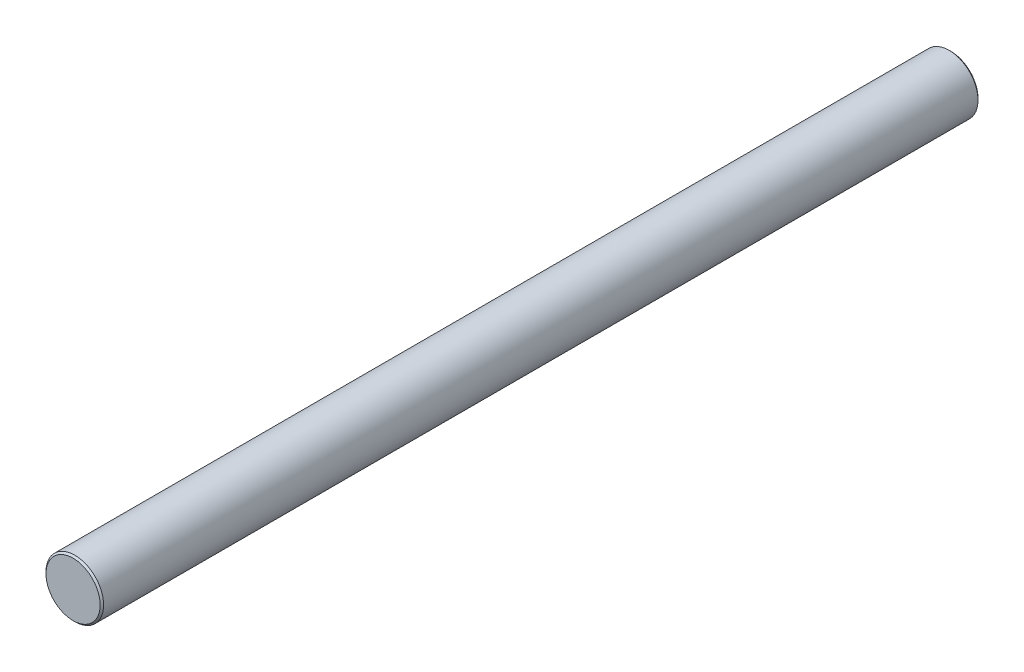
from build123d import *

# Parameters (mm, degrees)
SKETCH2_W     = 304.8
SKETCH2_H     = 10
CHAMFER1_SIZE = 0.6


with BuildPart() as part:
    # Sketch2 → Revolve1 (revolve)
    with BuildSketch(Plane(origin=(0, 0, 0), x_dir=(0, 0, -1), z_dir=(1, 0, 0))):
        with Locations((0, 5)):
            Rectangle(SKETCH2_W, SKETCH2_H)
    revolve(axis=Axis((0, 0, -152.4), (0, 0, 1)))

    # Chamfer1
    chamfer1_edges = [part.edges().sort_by_distance(p)[0] for p in [
        (0, -10, -152.4),
        (0, -10, 152.4),
    ]]
    chamfer(chamfer1_edges, length=CHAMFER1_SIZE)


solid = part.part
